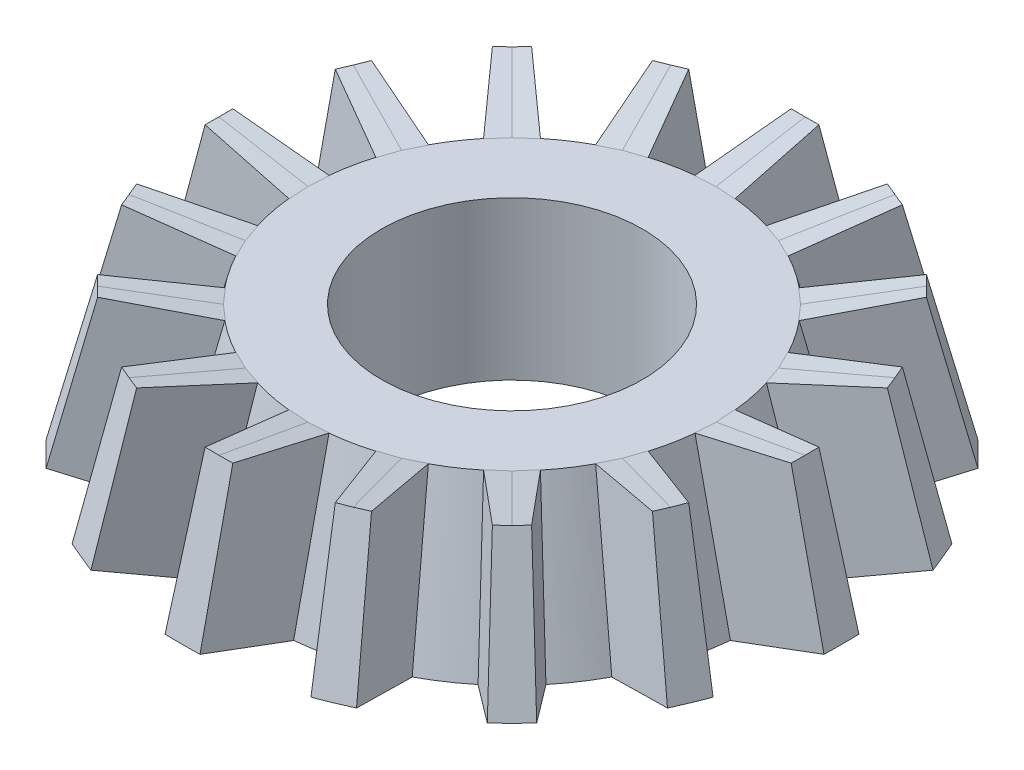
from build123d import *

# Parameters (mm, degrees)
BOSS_EXTRUDE1_DEPTH           = 3.8
BOSS_EXTRUDE1_TAPER           = 4
BOSS_EXTRUDE1_OTHER_WAY_DEPTH = 0.1
BOSS_EXTRUDE1_OTHER_WAY_DRAFT = 4
CIRPATTERN5_COUNT             = 16
CIRPATTERN5_COPY_1_DEPTH      = 0.1
CIRPATTERN5_COPY_1_DRAFT      = 4
CIRPATTERN5_COPY_2_DEPTH      = 0.1
CIRPATTERN5_COPY_2_DRAFT      = 4
CIRPATTERN5_COPY_3_DEPTH      = 0.1
CIRPATTERN5_COPY_3_DRAFT      = 4
CIRPATTERN5_COPY_4_DEPTH      = 0.1
CIRPATTERN5_COPY_4_DRAFT      = 4
CIRPATTERN5_COPY_5_DEPTH      = 0.1
CIRPATTERN5_COPY_5_DRAFT      = 4
CIRPATTERN5_COPY_6_DEPTH      = 0.1
CIRPATTERN5_COPY_6_DRAFT      = 4
CIRPATTERN5_COPY_7_DEPTH      = 0.1
CIRPATTERN5_COPY_7_DRAFT      = 4
CIRPATTERN5_COPY_8_DEPTH      = 0.1
CIRPATTERN5_COPY_8_DRAFT      = 4
CIRPATTERN5_COPY_9_DEPTH      = 0.1
CIRPATTERN5_COPY_9_DRAFT      = 4
CIRPATTERN5_COPY_10_DEPTH     = 0.1
CIRPATTERN5_COPY_10_DRAFT     = 4
CIRPATTERN5_COPY_11_DEPTH     = 0.1
CIRPATTERN5_COPY_11_DRAFT     = 4
CIRPATTERN5_COPY_12_DEPTH     = 0.1
CIRPATTERN5_COPY_12_DRAFT     = 4
CIRPATTERN5_COPY_13_DEPTH     = 0.1
CIRPATTERN5_COPY_13_DRAFT     = 4
CIRPATTERN5_COPY_14_DEPTH     = 0.1
CIRPATTERN5_COPY_14_DRAFT     = 4
CIRPATTERN5_COPY_15_DEPTH     = 0.1
CIRPATTERN5_COPY_15_DRAFT     = 4
CIRPATTERN5_COPY_16_DEPTH     = 0.1
CIRPATTERN5_COPY_16_DRAFT     = 4
CIRPATTERN5_COPY_17_DEPTH     = 0.1
CIRPATTERN5_COPY_17_DRAFT     = 4
CIRPATTERN5_COPY_18_DEPTH     = 0.1
CIRPATTERN5_COPY_18_DRAFT     = 4
CIRPATTERN5_COPY_19_DEPTH     = 0.1
CIRPATTERN5_COPY_19_DRAFT     = 4
CIRPATTERN5_COPY_20_DEPTH     = 0.1
CIRPATTERN5_COPY_20_DRAFT     = 4
CIRPATTERN5_COPY_21_DEPTH     = 0.1
CIRPATTERN5_COPY_21_DRAFT     = 4
CIRPATTERN5_COPY_22_DEPTH     = 0.1
CIRPATTERN5_COPY_22_DRAFT     = 4
CIRPATTERN5_COPY_23_DEPTH     = 0.1
CIRPATTERN5_COPY_23_DRAFT     = 4
CIRPATTERN5_COPY_24_DEPTH     = 0.1
CIRPATTERN5_COPY_24_DRAFT     = 4
CIRPATTERN5_COPY_25_DEPTH     = 0.1
CIRPATTERN5_COPY_25_DRAFT     = 4
CIRPATTERN5_COPY_26_DEPTH     = 0.1
CIRPATTERN5_COPY_26_DRAFT     = 4
CIRPATTERN5_COPY_27_DEPTH     = 0.1
CIRPATTERN5_COPY_27_DRAFT     = 4
CIRPATTERN5_COPY_28_DEPTH     = 0.1
CIRPATTERN5_COPY_28_DRAFT     = 4
CIRPATTERN5_COPY_29_DEPTH     = 0.1
CIRPATTERN5_COPY_29_DRAFT     = 4
CIRPATTERN5_COPY_30_DEPTH     = 0.1
CIRPATTERN5_COPY_30_DRAFT     = 4
SKETCH9_R                     = 5.5
CUT_EXTRUDE1_DEPTH            = 11.5
SKETCH11_R                    = 13.97
CUT_EXTRUDE4_DEPTH            = 10


with BuildPart() as part:
    # Sketch1 → Revolve1 (revolve)
    with BuildSketch(Plane.XY):
        Polygon((0, 0), (10.264, 0), (8.599769277, 6.655068452), (0, 6.655068452), align=None)
    revolve(axis=Axis((0, 6.655068452, 0), (0, -1, 0)))

    # Sketch8 → Boss-Extrude1 (add)
    with BuildSketch(Plane(origin=(0, 2.41565258, 9.659918574), x_dir=(1, 0, 0), z_dir=(0, 0.24259923079541193, 0.9701265964901048))):
        Polygon((0, 4.369961495), (-0.8443, 4.380040474), (-1.0077, -2.478008782), (0, -2.490038505), (1.0077, -2.478008782), (0.8443, 4.380040474), align=None)
    boss_extrude1 = extrude(amount=BOSS_EXTRUDE1_DEPTH, taper=BOSS_EXTRUDE1_TAPER)


with BuildPart() as boss_extrude1_other_way_tool:
    # Sketch8 → Boss-Extrude1 other way (with draft: the straight prism first)
    with BuildSketch(Plane(origin=(0, 2.41565258, 9.659918574), x_dir=(1, 0, 0), z_dir=(0, 0.24259923079541193, 0.9701265964901048))):
        Polygon((0, 4.369961495), (-0.8443, 4.380040474), (-1.0077, -2.478008782), (0, -2.490038505), (1.0077, -2.478008782), (0.8443, 4.380040474), align=None)
    extrude(amount=-BOSS_EXTRUDE1_OTHER_WAY_DEPTH)
    # Boss-Extrude1 other way: the draft: its side faces are tilted about the plane it starts from
    boss_extrude1_other_way_sides = [boss_extrude1_other_way_tool.faces().sort_by_distance(p)[0] for p in [
        (-0.42215, 6.647827433, 8.550040371),
        (-0.926, 3.326128384, 9.380696532),
        (-0.50385, -0.006294784, 10.214034469),
        (0.50385, -0.006294784, 10.214034469),
        (0.926, 3.326128384, 9.380696532),
        (0.42215, 6.647827433, 8.550040371),
    ]]
    draft(boss_extrude1_other_way_sides, Plane(origin=(0, 2.41565258, 9.659918574), x_dir=(1, 0, 0), z_dir=(0, 0.24259923079541193, 0.9701265964901048)), BOSS_EXTRUDE1_OTHER_WAY_DRAFT)


with BuildPart() as part_1:
    add(part.part)

    # Boss-Extrude1 other way: add boss_extrude1_other_way_tool
    add(boss_extrude1_other_way_tool.part)

    # CirPattern5: Boss-Extrude1 ×16 about axis
    cirpattern5_axis = Axis((0, 67.611042395, 0), (0, -1, 0))
    for i in range(1, CIRPATTERN5_COUNT):
        add(boss_extrude1.rotate(cirpattern5_axis, i * 360 / CIRPATTERN5_COUNT))


with BuildPart() as cirpattern5_copy_1_tool:
    # CirPattern5 copy 1 sketch → CirPattern5 copy 1 (with draft: the straight prism first)
    with BuildSketch(Plane(origin=(-3.696690796, 2.41565258, 8.924601056), x_dir=(0.9238795325112867, 0, 0.3826834323650898), z_dir=(-0.37125137577349576, 0.24259923079541193, 0.8962801064420437))):
        Polygon((0, 4.369961495), (-0.8443, 4.380040474), (-1.0077, -2.478008782), (0, -2.490038505), (1.0077, -2.478008782), (0.8443, 4.380040474), align=None)
    extrude(amount=-CIRPATTERN5_COPY_1_DEPTH)
    # CirPattern5 copy 1: the draft: its side faces are tilted about the plane it starts from
    cirpattern5_copy_1_sides = [cirpattern5_copy_1_tool.faces().sort_by_distance(p)[0] for p in [
        (-3.661974541, 6.647827433, 7.73765749),
        (-4.445349594, 3.326128384, 8.312268668),
        (-4.374238471, -0.006294784, 9.243722343),
        (-3.443245066, -0.006294784, 9.629352438),
        (-2.7343247, 3.326128384, 9.020998385),
        (-2.881943051, 6.647827433, 8.060757112),
    ]]
    draft(cirpattern5_copy_1_sides, Plane(origin=(-3.696690796, 2.41565258, 8.924601056), x_dir=(0.9238795325112867, 0, 0.3826834323650898), z_dir=(-0.37125137577349576, 0.24259923079541193, 0.8962801064420437)), CIRPATTERN5_COPY_1_DRAFT)


with BuildPart() as part_2:
    add(part_1.part)

    # CirPattern5 copy 1: add cirpattern5_copy_1_tool
    add(cirpattern5_copy_1_tool.part)


with BuildPart() as cirpattern5_copy_2_tool:
    # CirPattern5 copy 2 sketch → CirPattern5 copy 2 (with draft: the straight prism first)
    with BuildSketch(Plane(origin=(-6.830593929, 2.41565258, 6.830593929), x_dir=(0.7071067811865476, 0, 0.7071067811865475), z_dir=(-0.6859830949875786, 0.24259923079541193, 0.6859830949875787))):
        Polygon((0, 4.369961495), (-0.8443, 4.380040474), (-1.0077, -2.478008782), (0, -2.490038505), (1.0077, -2.478008782), (0.8443, 4.380040474), align=None)
    extrude(amount=-CIRPATTERN5_COPY_2_DEPTH)
    # CirPattern5 copy 2: the draft: its side faces are tilted about the plane it starts from
    cirpattern5_copy_2_sides = [cirpattern5_copy_2_tool.faces().sort_by_distance(p)[0] for p in [
        (-6.344296653, 6.647827433, 5.747286398),
        (-7.287935009, 3.326128384, 5.978373251),
        (-7.578688788, -0.006294784, 6.866137285),
        (-6.866137285, -0.006294784, 7.578688788),
        (-5.978373251, 3.326128384, 7.287935009),
        (-5.747286398, 6.647827433, 6.344296653),
    ]]
    draft(cirpattern5_copy_2_sides, Plane(origin=(-6.830593929, 2.41565258, 6.830593929), x_dir=(0.7071067811865476, 0, 0.7071067811865475), z_dir=(-0.6859830949875786, 0.24259923079541193, 0.6859830949875787)), CIRPATTERN5_COPY_2_DRAFT)


with BuildPart() as part_3:
    add(part_2.part)

    # CirPattern5 copy 2: add cirpattern5_copy_2_tool
    add(cirpattern5_copy_2_tool.part)


with BuildPart() as cirpattern5_copy_3_tool:
    # CirPattern5 copy 3 sketch → CirPattern5 copy 3 (with draft: the straight prism first)
    with BuildSketch(Plane(origin=(-8.924601056, 2.41565258, 3.696690796), x_dir=(0.38268343236508984, 0, 0.9238795325112867), z_dir=(-0.8962801064420437, 0.24259923079541193, 0.3712513757734958))):
        Polygon((0, 4.369961495), (-0.8443, 4.380040474), (-1.0077, -2.478008782), (0, -2.490038505), (1.0077, -2.478008782), (0.8443, 4.380040474), align=None)
    extrude(amount=-CIRPATTERN5_COPY_3_DEPTH)
    # CirPattern5 copy 3: the draft: its side faces are tilted about the plane it starts from
    cirpattern5_copy_3_sides = [cirpattern5_copy_3_tool.faces().sort_by_distance(p)[0] for p in [
        (-8.060757112, 6.647827433, 2.881943051),
        (-9.020998385, 3.326128384, 2.7343247),
        (-9.629352438, -0.006294784, 3.443245066),
        (-9.243722343, -0.006294784, 4.374238471),
        (-8.312268668, 3.326128384, 4.445349594),
        (-7.73765749, 6.647827433, 3.661974541),
    ]]
    draft(cirpattern5_copy_3_sides, Plane(origin=(-8.924601056, 2.41565258, 3.696690796), x_dir=(0.38268343236508984, 0, 0.9238795325112867), z_dir=(-0.8962801064420437, 0.24259923079541193, 0.3712513757734958)), CIRPATTERN5_COPY_3_DRAFT)


with BuildPart() as part_4:
    add(part_3.part)

    # CirPattern5 copy 3: add cirpattern5_copy_3_tool
    add(cirpattern5_copy_3_tool.part)


with BuildPart() as cirpattern5_copy_4_tool:
    # CirPattern5 copy 4 sketch → CirPattern5 copy 4 (with draft: the straight prism first)
    with BuildSketch(Plane(origin=(-9.659918574, 2.41565258, 0), x_dir=(0, 0, 1), z_dir=(-0.9701265964901048, 0.24259923079541193, 0))):
        Polygon((0, 4.369961495), (-0.8443, 4.380040474), (-1.0077, -2.478008782), (0, -2.490038505), (1.0077, -2.478008782), (0.8443, 4.380040474), align=None)
    extrude(amount=-CIRPATTERN5_COPY_4_DEPTH)
    # CirPattern5 copy 4: the draft: its side faces are tilted about the plane it starts from
    cirpattern5_copy_4_sides = [cirpattern5_copy_4_tool.faces().sort_by_distance(p)[0] for p in [
        (-8.550040371, 6.647827433, -0.42215),
        (-9.380696532, 3.326128384, -0.926),
        (-10.214034469, -0.006294784, -0.50385),
        (-10.214034469, -0.006294784, 0.50385),
        (-9.380696532, 3.326128384, 0.926),
        (-8.550040371, 6.647827433, 0.42215),
    ]]
    draft(cirpattern5_copy_4_sides, Plane(origin=(-9.659918574, 2.41565258, 0), x_dir=(0, 0, 1), z_dir=(-0.9701265964901048, 0.24259923079541193, 0)), CIRPATTERN5_COPY_4_DRAFT)


with BuildPart() as part_5:
    add(part_4.part)

    # CirPattern5 copy 4: add cirpattern5_copy_4_tool
    add(cirpattern5_copy_4_tool.part)


with BuildPart() as cirpattern5_copy_5_tool:
    # CirPattern5 copy 5 sketch → CirPattern5 copy 5 (with draft: the straight prism first)
    with BuildSketch(Plane(origin=(-8.924601056, 2.41565258, -3.696690796), x_dir=(-0.3826834323650897, 0, 0.9238795325112867), z_dir=(-0.8962801064420437, 0.2425992307954119, -0.3712513757734957))):
        Polygon((0, 4.369961495), (-0.8443, 4.380040474), (-1.0077, -2.478008782), (0, -2.490038505), (1.0077, -2.478008782), (0.8443, 4.380040474), align=None)
    extrude(amount=-CIRPATTERN5_COPY_5_DEPTH)
    # CirPattern5 copy 5: the draft: its side faces are tilted about the plane it starts from
    cirpattern5_copy_5_sides = [cirpattern5_copy_5_tool.faces().sort_by_distance(p)[0] for p in [
        (-7.73765749, 6.647827433, -3.661974541),
        (-8.312268668, 3.326128384, -4.445349594),
        (-9.243722343, -0.006294784, -4.374238471),
        (-9.629352438, -0.006294784, -3.443245066),
        (-9.020998385, 3.326128384, -2.7343247),
        (-8.060757112, 6.647827433, -2.881943051),
    ]]
    draft(cirpattern5_copy_5_sides, Plane(origin=(-8.924601056, 2.41565258, -3.696690796), x_dir=(-0.3826834323650897, 0, 0.9238795325112867), z_dir=(-0.8962801064420437, 0.2425992307954119, -0.3712513757734957)), CIRPATTERN5_COPY_5_DRAFT)


with BuildPart() as part_6:
    add(part_5.part)

    # CirPattern5 copy 5: add cirpattern5_copy_5_tool
    add(cirpattern5_copy_5_tool.part)


with BuildPart() as cirpattern5_copy_6_tool:
    # CirPattern5 copy 6 sketch → CirPattern5 copy 6 (with draft: the straight prism first)
    with BuildSketch(Plane(origin=(-6.830593929, 2.41565258, -6.830593929), x_dir=(-0.7071067811865475, 0, 0.7071067811865476), z_dir=(-0.6859830949875787, 0.24259923079541193, -0.6859830949875786))):
        Polygon((0, 4.369961495), (-0.8443, 4.380040474), (-1.0077, -2.478008782), (0, -2.490038505), (1.0077, -2.478008782), (0.8443, 4.380040474), align=None)
    extrude(amount=-CIRPATTERN5_COPY_6_DEPTH)
    # CirPattern5 copy 6: the draft: its side faces are tilted about the plane it starts from
    cirpattern5_copy_6_sides = [cirpattern5_copy_6_tool.faces().sort_by_distance(p)[0] for p in [
        (-5.747286398, 6.647827433, -6.344296653),
        (-5.978373251, 3.326128384, -7.287935009),
        (-6.866137285, -0.006294784, -7.578688788),
        (-7.578688788, -0.006294784, -6.866137285),
        (-7.287935009, 3.326128384, -5.978373251),
        (-6.344296653, 6.647827433, -5.747286398),
    ]]
    draft(cirpattern5_copy_6_sides, Plane(origin=(-6.830593929, 2.41565258, -6.830593929), x_dir=(-0.7071067811865475, 0, 0.7071067811865476), z_dir=(-0.6859830949875787, 0.24259923079541193, -0.6859830949875786)), CIRPATTERN5_COPY_6_DRAFT)


with BuildPart() as part_7:
    add(part_6.part)

    # CirPattern5 copy 6: add cirpattern5_copy_6_tool
    add(cirpattern5_copy_6_tool.part)


with BuildPart() as cirpattern5_copy_7_tool:
    # CirPattern5 copy 7 sketch → CirPattern5 copy 7 (with draft: the straight prism first)
    with BuildSketch(Plane(origin=(-3.696690796, 2.41565258, -8.924601056), x_dir=(-0.9238795325112867, 0, 0.3826834323650899), z_dir=(-0.3712513757734959, 0.24259923079541193, -0.8962801064420437))):
        Polygon((0, 4.369961495), (-0.8443, 4.380040474), (-1.0077, -2.478008782), (0, -2.490038505), (1.0077, -2.478008782), (0.8443, 4.380040474), align=None)
    extrude(amount=-CIRPATTERN5_COPY_7_DEPTH)
    # CirPattern5 copy 7: the draft: its side faces are tilted about the plane it starts from
    cirpattern5_copy_7_sides = [cirpattern5_copy_7_tool.faces().sort_by_distance(p)[0] for p in [
        (-2.881943051, 6.647827433, -8.060757112),
        (-2.7343247, 3.326128384, -9.020998385),
        (-3.443245066, -0.006294784, -9.629352438),
        (-4.374238471, -0.006294784, -9.243722343),
        (-4.445349594, 3.326128384, -8.312268668),
        (-3.661974541, 6.647827433, -7.73765749),
    ]]
    draft(cirpattern5_copy_7_sides, Plane(origin=(-3.696690796, 2.41565258, -8.924601056), x_dir=(-0.9238795325112867, 0, 0.3826834323650899), z_dir=(-0.3712513757734959, 0.24259923079541193, -0.8962801064420437)), CIRPATTERN5_COPY_7_DRAFT)


with BuildPart() as part_8:
    add(part_7.part)

    # CirPattern5 copy 7: add cirpattern5_copy_7_tool
    add(cirpattern5_copy_7_tool.part)


with BuildPart() as cirpattern5_copy_8_tool:
    # CirPattern5 copy 8 sketch → CirPattern5 copy 8 (with draft: the straight prism first)
    with BuildSketch(Plane(origin=(0, 2.41565258, -9.659918574), x_dir=(-1, 0, 0), z_dir=(0, 0.24259923079541193, -0.9701265964901048))):
        Polygon((0, 4.369961495), (-0.8443, 4.380040474), (-1.0077, -2.478008782), (0, -2.490038505), (1.0077, -2.478008782), (0.8443, 4.380040474), align=None)
    extrude(amount=-CIRPATTERN5_COPY_8_DEPTH)
    # CirPattern5 copy 8: the draft: its side faces are tilted about the plane it starts from
    cirpattern5_copy_8_sides = [cirpattern5_copy_8_tool.faces().sort_by_distance(p)[0] for p in [
        (0.42215, 6.647827433, -8.550040371),
        (0.926, 3.326128384, -9.380696532),
        (0.50385, -0.006294784, -10.214034469),
        (-0.50385, -0.006294784, -10.214034469),
        (-0.926, 3.326128384, -9.380696532),
        (-0.42215, 6.647827433, -8.550040371),
    ]]
    draft(cirpattern5_copy_8_sides, Plane(origin=(0, 2.41565258, -9.659918574), x_dir=(-1, 0, 0), z_dir=(0, 0.24259923079541193, -0.9701265964901048)), CIRPATTERN5_COPY_8_DRAFT)


with BuildPart() as part_9:
    add(part_8.part)

    # CirPattern5 copy 8: add cirpattern5_copy_8_tool
    add(cirpattern5_copy_8_tool.part)


with BuildPart() as cirpattern5_copy_9_tool:
    # CirPattern5 copy 9 sketch → CirPattern5 copy 9 (with draft: the straight prism first)
    with BuildSketch(Plane(origin=(3.696690796, 2.41565258, -8.924601056), x_dir=(-0.9238795325112868, 0, -0.38268343236508967), z_dir=(0.37125137577349565, 0.24259923079541193, -0.8962801064420438))):
        Polygon((0, 4.369961495), (-0.8443, 4.380040474), (-1.0077, -2.478008782), (0, -2.490038505), (1.0077, -2.478008782), (0.8443, 4.380040474), align=None)
    extrude(amount=-CIRPATTERN5_COPY_9_DEPTH)
    # CirPattern5 copy 9: the draft: its side faces are tilted about the plane it starts from
    cirpattern5_copy_9_sides = [cirpattern5_copy_9_tool.faces().sort_by_distance(p)[0] for p in [
        (3.661974541, 6.647827433, -7.73765749),
        (4.445349594, 3.326128384, -8.312268668),
        (4.374238471, -0.006294784, -9.243722343),
        (3.443245066, -0.006294784, -9.629352438),
        (2.7343247, 3.326128384, -9.020998385),
        (2.881943051, 6.647827433, -8.060757112),
    ]]
    draft(cirpattern5_copy_9_sides, Plane(origin=(3.696690796, 2.41565258, -8.924601056), x_dir=(-0.9238795325112868, 0, -0.38268343236508967), z_dir=(0.37125137577349565, 0.24259923079541193, -0.8962801064420438)), CIRPATTERN5_COPY_9_DRAFT)


with BuildPart() as part_10:
    add(part_9.part)

    # CirPattern5 copy 9: add cirpattern5_copy_9_tool
    add(cirpattern5_copy_9_tool.part)


with BuildPart() as cirpattern5_copy_10_tool:
    # CirPattern5 copy 10 sketch → CirPattern5 copy 10 (with draft: the straight prism first)
    with BuildSketch(Plane(origin=(6.830593929, 2.41565258, -6.830593929), x_dir=(-0.7071067811865477, 0, -0.7071067811865475), z_dir=(0.6859830949875786, 0.24259923079541193, -0.6859830949875788))):
        Polygon((0, 4.369961495), (-0.8443, 4.380040474), (-1.0077, -2.478008782), (0, -2.490038505), (1.0077, -2.478008782), (0.8443, 4.380040474), align=None)
    extrude(amount=-CIRPATTERN5_COPY_10_DEPTH)
    # CirPattern5 copy 10: the draft: its side faces are tilted about the plane it starts from
    cirpattern5_copy_10_sides = [cirpattern5_copy_10_tool.faces().sort_by_distance(p)[0] for p in [
        (6.344296653, 6.647827433, -5.747286398),
        (7.287935009, 3.326128384, -5.978373251),
        (7.578688788, -0.006294784, -6.866137285),
        (6.866137285, -0.006294784, -7.578688788),
        (5.978373251, 3.326128384, -7.287935009),
        (5.747286398, 6.647827433, -6.344296653),
    ]]
    draft(cirpattern5_copy_10_sides, Plane(origin=(6.830593929, 2.41565258, -6.830593929), x_dir=(-0.7071067811865477, 0, -0.7071067811865475), z_dir=(0.6859830949875786, 0.24259923079541193, -0.6859830949875788)), CIRPATTERN5_COPY_10_DRAFT)


with BuildPart() as part_11:
    add(part_10.part)

    # CirPattern5 copy 10: add cirpattern5_copy_10_tool
    add(cirpattern5_copy_10_tool.part)


with BuildPart() as cirpattern5_copy_11_tool:
    # CirPattern5 copy 11 sketch → CirPattern5 copy 11 (with draft: the straight prism first)
    with BuildSketch(Plane(origin=(8.924601056, 2.41565258, -3.696690796), x_dir=(-0.3826834323650895, 0, -0.9238795325112868), z_dir=(0.8962801064420438, 0.24259923079541193, -0.3712513757734955))):
        Polygon((0, 4.369961495), (-0.8443, 4.380040474), (-1.0077, -2.478008782), (0, -2.490038505), (1.0077, -2.478008782), (0.8443, 4.380040474), align=None)
    extrude(amount=-CIRPATTERN5_COPY_11_DEPTH)
    # CirPattern5 copy 11: the draft: its side faces are tilted about the plane it starts from
    cirpattern5_copy_11_sides = [cirpattern5_copy_11_tool.faces().sort_by_distance(p)[0] for p in [
        (8.060757112, 6.647827433, -2.881943051),
        (9.020998385, 3.326128384, -2.7343247),
        (9.629352438, -0.006294784, -3.443245066),
        (9.243722343, -0.006294784, -4.374238471),
        (8.312268668, 3.326128384, -4.445349594),
        (7.73765749, 6.647827433, -3.661974541),
    ]]
    draft(cirpattern5_copy_11_sides, Plane(origin=(8.924601056, 2.41565258, -3.696690796), x_dir=(-0.3826834323650895, 0, -0.9238795325112868), z_dir=(0.8962801064420438, 0.24259923079541193, -0.3712513757734955)), CIRPATTERN5_COPY_11_DRAFT)


with BuildPart() as part_12:
    add(part_11.part)

    # CirPattern5 copy 11: add cirpattern5_copy_11_tool
    add(cirpattern5_copy_11_tool.part)


with BuildPart() as cirpattern5_copy_12_tool:
    # CirPattern5 copy 12 sketch → CirPattern5 copy 12 (with draft: the straight prism first)
    with BuildSketch(Plane(origin=(9.659918574, 2.41565258, 0), x_dir=(0, 0, -1), z_dir=(0.9701265964901048, 0.24259923079541193, 0))):
        Polygon((0, 4.369961495), (-0.8443, 4.380040474), (-1.0077, -2.478008782), (0, -2.490038505), (1.0077, -2.478008782), (0.8443, 4.380040474), align=None)
    extrude(amount=-CIRPATTERN5_COPY_12_DEPTH)
    # CirPattern5 copy 12: the draft: its side faces are tilted about the plane it starts from
    cirpattern5_copy_12_sides = [cirpattern5_copy_12_tool.faces().sort_by_distance(p)[0] for p in [
        (8.550040371, 6.647827433, 0.42215),
        (9.380696532, 3.326128384, 0.926),
        (10.214034469, -0.006294784, 0.50385),
        (10.214034469, -0.006294784, -0.50385),
        (9.380696532, 3.326128384, -0.926),
        (8.550040371, 6.647827433, -0.42215),
    ]]
    draft(cirpattern5_copy_12_sides, Plane(origin=(9.659918574, 2.41565258, 0), x_dir=(0, 0, -1), z_dir=(0.9701265964901048, 0.24259923079541193, 0)), CIRPATTERN5_COPY_12_DRAFT)


with BuildPart() as part_13:
    add(part_12.part)

    # CirPattern5 copy 12: add cirpattern5_copy_12_tool
    add(cirpattern5_copy_12_tool.part)


with BuildPart() as cirpattern5_copy_13_tool:
    # CirPattern5 copy 13 sketch → CirPattern5 copy 13 (with draft: the straight prism first)
    with BuildSketch(Plane(origin=(8.924601056, 2.41565258, 3.696690796), x_dir=(0.38268343236509, 0, -0.9238795325112866), z_dir=(0.8962801064420436, 0.24259923079541193, 0.371251375773496))):
        Polygon((0, 4.369961495), (-0.8443, 4.380040474), (-1.0077, -2.478008782), (0, -2.490038505), (1.0077, -2.478008782), (0.8443, 4.380040474), align=None)
    extrude(amount=-CIRPATTERN5_COPY_13_DEPTH)
    # CirPattern5 copy 13: the draft: its side faces are tilted about the plane it starts from
    cirpattern5_copy_13_sides = [cirpattern5_copy_13_tool.faces().sort_by_distance(p)[0] for p in [
        (7.73765749, 6.647827433, 3.661974541),
        (8.312268668, 3.326128384, 4.445349594),
        (9.243722343, -0.006294784, 4.374238471),
        (9.629352438, -0.006294784, 3.443245066),
        (9.020998385, 3.326128384, 2.7343247),
        (8.060757112, 6.647827433, 2.881943051),
    ]]
    draft(cirpattern5_copy_13_sides, Plane(origin=(8.924601056, 2.41565258, 3.696690796), x_dir=(0.38268343236509, 0, -0.9238795325112866), z_dir=(0.8962801064420436, 0.24259923079541193, 0.371251375773496)), CIRPATTERN5_COPY_13_DRAFT)


with BuildPart() as part_14:
    add(part_13.part)

    # CirPattern5 copy 13: add cirpattern5_copy_13_tool
    add(cirpattern5_copy_13_tool.part)


with BuildPart() as cirpattern5_copy_14_tool:
    # CirPattern5 copy 14 sketch → CirPattern5 copy 14 (with draft: the straight prism first)
    with BuildSketch(Plane(origin=(6.830593929, 2.41565258, 6.830593929), x_dir=(0.7071067811865474, 0, -0.7071067811865477), z_dir=(0.6859830949875788, 0.24259923079541193, 0.6859830949875785))):
        Polygon((0, 4.369961495), (-0.8443, 4.380040474), (-1.0077, -2.478008782), (0, -2.490038505), (1.0077, -2.478008782), (0.8443, 4.380040474), align=None)
    extrude(amount=-CIRPATTERN5_COPY_14_DEPTH)
    # CirPattern5 copy 14: the draft: its side faces are tilted about the plane it starts from
    cirpattern5_copy_14_sides = [cirpattern5_copy_14_tool.faces().sort_by_distance(p)[0] for p in [
        (5.747286398, 6.647827433, 6.344296653),
        (5.978373251, 3.326128384, 7.287935009),
        (6.866137285, -0.006294784, 7.578688788),
        (7.578688788, -0.006294784, 6.866137285),
        (7.287935009, 3.326128384, 5.978373251),
        (6.344296653, 6.647827433, 5.747286398),
    ]]
    draft(cirpattern5_copy_14_sides, Plane(origin=(6.830593929, 2.41565258, 6.830593929), x_dir=(0.7071067811865474, 0, -0.7071067811865477), z_dir=(0.6859830949875788, 0.24259923079541193, 0.6859830949875785)), CIRPATTERN5_COPY_14_DRAFT)


with BuildPart() as part_15:
    add(part_14.part)

    # CirPattern5 copy 14: add cirpattern5_copy_14_tool
    add(cirpattern5_copy_14_tool.part)


with BuildPart() as cirpattern5_copy_15_tool:
    # CirPattern5 copy 15 sketch → CirPattern5 copy 15 (with draft: the straight prism first)
    with BuildSketch(Plane(origin=(3.696690796, 2.41565258, 8.924601056), x_dir=(0.9238795325112868, 0, -0.38268343236508956), z_dir=(0.37125137577349554, 0.24259923079541193, 0.8962801064420438))):
        Polygon((0, 4.369961495), (-0.8443, 4.380040474), (-1.0077, -2.478008782), (0, -2.490038505), (1.0077, -2.478008782), (0.8443, 4.380040474), align=None)
    extrude(amount=-CIRPATTERN5_COPY_15_DEPTH)
    # CirPattern5 copy 15: the draft: its side faces are tilted about the plane it starts from
    cirpattern5_copy_15_sides = [cirpattern5_copy_15_tool.faces().sort_by_distance(p)[0] for p in [
        (2.881943051, 6.647827433, 8.060757112),
        (2.7343247, 3.326128384, 9.020998385),
        (3.443245066, -0.006294784, 9.629352438),
        (4.374238471, -0.006294784, 9.243722343),
        (4.445349594, 3.326128384, 8.312268668),
        (3.661974541, 6.647827433, 7.73765749),
    ]]
    draft(cirpattern5_copy_15_sides, Plane(origin=(3.696690796, 2.41565258, 8.924601056), x_dir=(0.9238795325112868, 0, -0.38268343236508956), z_dir=(0.37125137577349554, 0.24259923079541193, 0.8962801064420438)), CIRPATTERN5_COPY_15_DRAFT)


with BuildPart() as part_16:
    add(part_15.part)

    # CirPattern5 copy 15: add cirpattern5_copy_15_tool
    add(cirpattern5_copy_15_tool.part)


with BuildPart() as cirpattern5_copy_16_tool:
    # CirPattern5 copy 16 sketch → CirPattern5 copy 16 (with draft: the straight prism first)
    with BuildSketch(Plane(origin=(-3.696690796, 2.41565258, 8.924601056), x_dir=(0.9238795325112867, 0, 0.3826834323650898), z_dir=(-0.37125137577349576, 0.24259923079541193, 0.8962801064420437))):
        Polygon((0, 4.369961495), (-0.8443, 4.380040474), (-1.0077, -2.478008782), (0, -2.490038505), (1.0077, -2.478008782), (0.8443, 4.380040474), align=None)
    extrude(amount=-CIRPATTERN5_COPY_16_DEPTH)
    # CirPattern5 copy 16: the draft: its side faces are tilted about the plane it starts from
    cirpattern5_copy_16_sides = [cirpattern5_copy_16_tool.faces().sort_by_distance(p)[0] for p in [
        (-3.661974541, 6.647827433, 7.73765749),
        (-4.445349594, 3.326128384, 8.312268668),
        (-4.374238471, -0.006294784, 9.243722343),
        (-3.443245066, -0.006294784, 9.629352438),
        (-2.7343247, 3.326128384, 9.020998385),
        (-2.881943051, 6.647827433, 8.060757112),
    ]]
    draft(cirpattern5_copy_16_sides, Plane(origin=(-3.696690796, 2.41565258, 8.924601056), x_dir=(0.9238795325112867, 0, 0.3826834323650898), z_dir=(-0.37125137577349576, 0.24259923079541193, 0.8962801064420437)), CIRPATTERN5_COPY_16_DRAFT)


with BuildPart() as part_17:
    add(part_16.part)

    # CirPattern5 copy 16: add cirpattern5_copy_16_tool
    add(cirpattern5_copy_16_tool.part)


with BuildPart() as cirpattern5_copy_17_tool:
    # CirPattern5 copy 17 sketch → CirPattern5 copy 17 (with draft: the straight prism first)
    with BuildSketch(Plane(origin=(-6.830593929, 2.41565258, 6.830593929), x_dir=(0.7071067811865476, 0, 0.7071067811865475), z_dir=(-0.6859830949875786, 0.24259923079541193, 0.6859830949875787))):
        Polygon((0, 4.369961495), (-0.8443, 4.380040474), (-1.0077, -2.478008782), (0, -2.490038505), (1.0077, -2.478008782), (0.8443, 4.380040474), align=None)
    extrude(amount=-CIRPATTERN5_COPY_17_DEPTH)
    # CirPattern5 copy 17: the draft: its side faces are tilted about the plane it starts from
    cirpattern5_copy_17_sides = [cirpattern5_copy_17_tool.faces().sort_by_distance(p)[0] for p in [
        (-6.344296653, 6.647827433, 5.747286398),
        (-7.287935009, 3.326128384, 5.978373251),
        (-7.578688788, -0.006294784, 6.866137285),
        (-6.866137285, -0.006294784, 7.578688788),
        (-5.978373251, 3.326128384, 7.287935009),
        (-5.747286398, 6.647827433, 6.344296653),
    ]]
    draft(cirpattern5_copy_17_sides, Plane(origin=(-6.830593929, 2.41565258, 6.830593929), x_dir=(0.7071067811865476, 0, 0.7071067811865475), z_dir=(-0.6859830949875786, 0.24259923079541193, 0.6859830949875787)), CIRPATTERN5_COPY_17_DRAFT)


with BuildPart() as part_18:
    add(part_17.part)

    # CirPattern5 copy 17: add cirpattern5_copy_17_tool
    add(cirpattern5_copy_17_tool.part)


with BuildPart() as cirpattern5_copy_18_tool:
    # CirPattern5 copy 18 sketch → CirPattern5 copy 18 (with draft: the straight prism first)
    with BuildSketch(Plane(origin=(-8.924601056, 2.41565258, 3.696690796), x_dir=(0.38268343236508984, 0, 0.9238795325112867), z_dir=(-0.8962801064420437, 0.24259923079541193, 0.3712513757734958))):
        Polygon((0, 4.369961495), (-0.8443, 4.380040474), (-1.0077, -2.478008782), (0, -2.490038505), (1.0077, -2.478008782), (0.8443, 4.380040474), align=None)
    extrude(amount=-CIRPATTERN5_COPY_18_DEPTH)
    # CirPattern5 copy 18: the draft: its side faces are tilted about the plane it starts from
    cirpattern5_copy_18_sides = [cirpattern5_copy_18_tool.faces().sort_by_distance(p)[0] for p in [
        (-8.060757112, 6.647827433, 2.881943051),
        (-9.020998385, 3.326128384, 2.7343247),
        (-9.629352438, -0.006294784, 3.443245066),
        (-9.243722343, -0.006294784, 4.374238471),
        (-8.312268668, 3.326128384, 4.445349594),
        (-7.73765749, 6.647827433, 3.661974541),
    ]]
    draft(cirpattern5_copy_18_sides, Plane(origin=(-8.924601056, 2.41565258, 3.696690796), x_dir=(0.38268343236508984, 0, 0.9238795325112867), z_dir=(-0.8962801064420437, 0.24259923079541193, 0.3712513757734958)), CIRPATTERN5_COPY_18_DRAFT)


with BuildPart() as part_19:
    add(part_18.part)

    # CirPattern5 copy 18: add cirpattern5_copy_18_tool
    add(cirpattern5_copy_18_tool.part)


with BuildPart() as cirpattern5_copy_19_tool:
    # CirPattern5 copy 19 sketch → CirPattern5 copy 19 (with draft: the straight prism first)
    with BuildSketch(Plane(origin=(-9.659918574, 2.41565258, 0), x_dir=(0, 0, 1), z_dir=(-0.9701265964901048, 0.24259923079541193, 0))):
        Polygon((0, 4.369961495), (-0.8443, 4.380040474), (-1.0077, -2.478008782), (0, -2.490038505), (1.0077, -2.478008782), (0.8443, 4.380040474), align=None)
    extrude(amount=-CIRPATTERN5_COPY_19_DEPTH)
    # CirPattern5 copy 19: the draft: its side faces are tilted about the plane it starts from
    cirpattern5_copy_19_sides = [cirpattern5_copy_19_tool.faces().sort_by_distance(p)[0] for p in [
        (-8.550040371, 6.647827433, -0.42215),
        (-9.380696532, 3.326128384, -0.926),
        (-10.214034469, -0.006294784, -0.50385),
        (-10.214034469, -0.006294784, 0.50385),
        (-9.380696532, 3.326128384, 0.926),
        (-8.550040371, 6.647827433, 0.42215),
    ]]
    draft(cirpattern5_copy_19_sides, Plane(origin=(-9.659918574, 2.41565258, 0), x_dir=(0, 0, 1), z_dir=(-0.9701265964901048, 0.24259923079541193, 0)), CIRPATTERN5_COPY_19_DRAFT)


with BuildPart() as part_20:
    add(part_19.part)

    # CirPattern5 copy 19: add cirpattern5_copy_19_tool
    add(cirpattern5_copy_19_tool.part)


with BuildPart() as cirpattern5_copy_20_tool:
    # CirPattern5 copy 20 sketch → CirPattern5 copy 20 (with draft: the straight prism first)
    with BuildSketch(Plane(origin=(-8.924601056, 2.41565258, -3.696690796), x_dir=(-0.3826834323650897, 0, 0.9238795325112867), z_dir=(-0.8962801064420437, 0.2425992307954119, -0.3712513757734957))):
        Polygon((0, 4.369961495), (-0.8443, 4.380040474), (-1.0077, -2.478008782), (0, -2.490038505), (1.0077, -2.478008782), (0.8443, 4.380040474), align=None)
    extrude(amount=-CIRPATTERN5_COPY_20_DEPTH)
    # CirPattern5 copy 20: the draft: its side faces are tilted about the plane it starts from
    cirpattern5_copy_20_sides = [cirpattern5_copy_20_tool.faces().sort_by_distance(p)[0] for p in [
        (-7.73765749, 6.647827433, -3.661974541),
        (-8.312268668, 3.326128384, -4.445349594),
        (-9.243722343, -0.006294784, -4.374238471),
        (-9.629352438, -0.006294784, -3.443245066),
        (-9.020998385, 3.326128384, -2.7343247),
        (-8.060757112, 6.647827433, -2.881943051),
    ]]
    draft(cirpattern5_copy_20_sides, Plane(origin=(-8.924601056, 2.41565258, -3.696690796), x_dir=(-0.3826834323650897, 0, 0.9238795325112867), z_dir=(-0.8962801064420437, 0.2425992307954119, -0.3712513757734957)), CIRPATTERN5_COPY_20_DRAFT)


with BuildPart() as part_21:
    add(part_20.part)

    # CirPattern5 copy 20: add cirpattern5_copy_20_tool
    add(cirpattern5_copy_20_tool.part)


with BuildPart() as cirpattern5_copy_21_tool:
    # CirPattern5 copy 21 sketch → CirPattern5 copy 21 (with draft: the straight prism first)
    with BuildSketch(Plane(origin=(-6.830593929, 2.41565258, -6.830593929), x_dir=(-0.7071067811865475, 0, 0.7071067811865476), z_dir=(-0.6859830949875787, 0.24259923079541193, -0.6859830949875786))):
        Polygon((0, 4.369961495), (-0.8443, 4.380040474), (-1.0077, -2.478008782), (0, -2.490038505), (1.0077, -2.478008782), (0.8443, 4.380040474), align=None)
    extrude(amount=-CIRPATTERN5_COPY_21_DEPTH)
    # CirPattern5 copy 21: the draft: its side faces are tilted about the plane it starts from
    cirpattern5_copy_21_sides = [cirpattern5_copy_21_tool.faces().sort_by_distance(p)[0] for p in [
        (-5.747286398, 6.647827433, -6.344296653),
        (-5.978373251, 3.326128384, -7.287935009),
        (-6.866137285, -0.006294784, -7.578688788),
        (-7.578688788, -0.006294784, -6.866137285),
        (-7.287935009, 3.326128384, -5.978373251),
        (-6.344296653, 6.647827433, -5.747286398),
    ]]
    draft(cirpattern5_copy_21_sides, Plane(origin=(-6.830593929, 2.41565258, -6.830593929), x_dir=(-0.7071067811865475, 0, 0.7071067811865476), z_dir=(-0.6859830949875787, 0.24259923079541193, -0.6859830949875786)), CIRPATTERN5_COPY_21_DRAFT)


with BuildPart() as part_22:
    add(part_21.part)

    # CirPattern5 copy 21: add cirpattern5_copy_21_tool
    add(cirpattern5_copy_21_tool.part)


with BuildPart() as cirpattern5_copy_22_tool:
    # CirPattern5 copy 22 sketch → CirPattern5 copy 22 (with draft: the straight prism first)
    with BuildSketch(Plane(origin=(-3.696690796, 2.41565258, -8.924601056), x_dir=(-0.9238795325112867, 0, 0.3826834323650899), z_dir=(-0.3712513757734959, 0.24259923079541193, -0.8962801064420437))):
        Polygon((0, 4.369961495), (-0.8443, 4.380040474), (-1.0077, -2.478008782), (0, -2.490038505), (1.0077, -2.478008782), (0.8443, 4.380040474), align=None)
    extrude(amount=-CIRPATTERN5_COPY_22_DEPTH)
    # CirPattern5 copy 22: the draft: its side faces are tilted about the plane it starts from
    cirpattern5_copy_22_sides = [cirpattern5_copy_22_tool.faces().sort_by_distance(p)[0] for p in [
        (-2.881943051, 6.647827433, -8.060757112),
        (-2.7343247, 3.326128384, -9.020998385),
        (-3.443245066, -0.006294784, -9.629352438),
        (-4.374238471, -0.006294784, -9.243722343),
        (-4.445349594, 3.326128384, -8.312268668),
        (-3.661974541, 6.647827433, -7.73765749),
    ]]
    draft(cirpattern5_copy_22_sides, Plane(origin=(-3.696690796, 2.41565258, -8.924601056), x_dir=(-0.9238795325112867, 0, 0.3826834323650899), z_dir=(-0.3712513757734959, 0.24259923079541193, -0.8962801064420437)), CIRPATTERN5_COPY_22_DRAFT)


with BuildPart() as part_23:
    add(part_22.part)

    # CirPattern5 copy 22: add cirpattern5_copy_22_tool
    add(cirpattern5_copy_22_tool.part)


with BuildPart() as cirpattern5_copy_23_tool:
    # CirPattern5 copy 23 sketch → CirPattern5 copy 23 (with draft: the straight prism first)
    with BuildSketch(Plane(origin=(0, 2.41565258, -9.659918574), x_dir=(-1, 0, 0), z_dir=(0, 0.24259923079541193, -0.9701265964901048))):
        Polygon((0, 4.369961495), (-0.8443, 4.380040474), (-1.0077, -2.478008782), (0, -2.490038505), (1.0077, -2.478008782), (0.8443, 4.380040474), align=None)
    extrude(amount=-CIRPATTERN5_COPY_23_DEPTH)
    # CirPattern5 copy 23: the draft: its side faces are tilted about the plane it starts from
    cirpattern5_copy_23_sides = [cirpattern5_copy_23_tool.faces().sort_by_distance(p)[0] for p in [
        (0.42215, 6.647827433, -8.550040371),
        (0.926, 3.326128384, -9.380696532),
        (0.50385, -0.006294784, -10.214034469),
        (-0.50385, -0.006294784, -10.214034469),
        (-0.926, 3.326128384, -9.380696532),
        (-0.42215, 6.647827433, -8.550040371),
    ]]
    draft(cirpattern5_copy_23_sides, Plane(origin=(0, 2.41565258, -9.659918574), x_dir=(-1, 0, 0), z_dir=(0, 0.24259923079541193, -0.9701265964901048)), CIRPATTERN5_COPY_23_DRAFT)


with BuildPart() as part_24:
    add(part_23.part)

    # CirPattern5 copy 23: add cirpattern5_copy_23_tool
    add(cirpattern5_copy_23_tool.part)


with BuildPart() as cirpattern5_copy_24_tool:
    # CirPattern5 copy 24 sketch → CirPattern5 copy 24 (with draft: the straight prism first)
    with BuildSketch(Plane(origin=(3.696690796, 2.41565258, -8.924601056), x_dir=(-0.9238795325112868, 0, -0.38268343236508967), z_dir=(0.37125137577349565, 0.24259923079541193, -0.8962801064420438))):
        Polygon((0, 4.369961495), (-0.8443, 4.380040474), (-1.0077, -2.478008782), (0, -2.490038505), (1.0077, -2.478008782), (0.8443, 4.380040474), align=None)
    extrude(amount=-CIRPATTERN5_COPY_24_DEPTH)
    # CirPattern5 copy 24: the draft: its side faces are tilted about the plane it starts from
    cirpattern5_copy_24_sides = [cirpattern5_copy_24_tool.faces().sort_by_distance(p)[0] for p in [
        (3.661974541, 6.647827433, -7.73765749),
        (4.445349594, 3.326128384, -8.312268668),
        (4.374238471, -0.006294784, -9.243722343),
        (3.443245066, -0.006294784, -9.629352438),
        (2.7343247, 3.326128384, -9.020998385),
        (2.881943051, 6.647827433, -8.060757112),
    ]]
    draft(cirpattern5_copy_24_sides, Plane(origin=(3.696690796, 2.41565258, -8.924601056), x_dir=(-0.9238795325112868, 0, -0.38268343236508967), z_dir=(0.37125137577349565, 0.24259923079541193, -0.8962801064420438)), CIRPATTERN5_COPY_24_DRAFT)


with BuildPart() as part_25:
    add(part_24.part)

    # CirPattern5 copy 24: add cirpattern5_copy_24_tool
    add(cirpattern5_copy_24_tool.part)


with BuildPart() as cirpattern5_copy_25_tool:
    # CirPattern5 copy 25 sketch → CirPattern5 copy 25 (with draft: the straight prism first)
    with BuildSketch(Plane(origin=(6.830593929, 2.41565258, -6.830593929), x_dir=(-0.7071067811865477, 0, -0.7071067811865475), z_dir=(0.6859830949875786, 0.24259923079541193, -0.6859830949875788))):
        Polygon((0, 4.369961495), (-0.8443, 4.380040474), (-1.0077, -2.478008782), (0, -2.490038505), (1.0077, -2.478008782), (0.8443, 4.380040474), align=None)
    extrude(amount=-CIRPATTERN5_COPY_25_DEPTH)
    # CirPattern5 copy 25: the draft: its side faces are tilted about the plane it starts from
    cirpattern5_copy_25_sides = [cirpattern5_copy_25_tool.faces().sort_by_distance(p)[0] for p in [
        (6.344296653, 6.647827433, -5.747286398),
        (7.287935009, 3.326128384, -5.978373251),
        (7.578688788, -0.006294784, -6.866137285),
        (6.866137285, -0.006294784, -7.578688788),
        (5.978373251, 3.326128384, -7.287935009),
        (5.747286398, 6.647827433, -6.344296653),
    ]]
    draft(cirpattern5_copy_25_sides, Plane(origin=(6.830593929, 2.41565258, -6.830593929), x_dir=(-0.7071067811865477, 0, -0.7071067811865475), z_dir=(0.6859830949875786, 0.24259923079541193, -0.6859830949875788)), CIRPATTERN5_COPY_25_DRAFT)


with BuildPart() as part_26:
    add(part_25.part)

    # CirPattern5 copy 25: add cirpattern5_copy_25_tool
    add(cirpattern5_copy_25_tool.part)


with BuildPart() as cirpattern5_copy_26_tool:
    # CirPattern5 copy 26 sketch → CirPattern5 copy 26 (with draft: the straight prism first)
    with BuildSketch(Plane(origin=(8.924601056, 2.41565258, -3.696690796), x_dir=(-0.3826834323650895, 0, -0.9238795325112868), z_dir=(0.8962801064420438, 0.24259923079541193, -0.3712513757734955))):
        Polygon((0, 4.369961495), (-0.8443, 4.380040474), (-1.0077, -2.478008782), (0, -2.490038505), (1.0077, -2.478008782), (0.8443, 4.380040474), align=None)
    extrude(amount=-CIRPATTERN5_COPY_26_DEPTH)
    # CirPattern5 copy 26: the draft: its side faces are tilted about the plane it starts from
    cirpattern5_copy_26_sides = [cirpattern5_copy_26_tool.faces().sort_by_distance(p)[0] for p in [
        (8.060757112, 6.647827433, -2.881943051),
        (9.020998385, 3.326128384, -2.7343247),
        (9.629352438, -0.006294784, -3.443245066),
        (9.243722343, -0.006294784, -4.374238471),
        (8.312268668, 3.326128384, -4.445349594),
        (7.73765749, 6.647827433, -3.661974541),
    ]]
    draft(cirpattern5_copy_26_sides, Plane(origin=(8.924601056, 2.41565258, -3.696690796), x_dir=(-0.3826834323650895, 0, -0.9238795325112868), z_dir=(0.8962801064420438, 0.24259923079541193, -0.3712513757734955)), CIRPATTERN5_COPY_26_DRAFT)


with BuildPart() as part_27:
    add(part_26.part)

    # CirPattern5 copy 26: add cirpattern5_copy_26_tool
    add(cirpattern5_copy_26_tool.part)


with BuildPart() as cirpattern5_copy_27_tool:
    # CirPattern5 copy 27 sketch → CirPattern5 copy 27 (with draft: the straight prism first)
    with BuildSketch(Plane(origin=(9.659918574, 2.41565258, 0), x_dir=(0, 0, -1), z_dir=(0.9701265964901048, 0.24259923079541193, 0))):
        Polygon((0, 4.369961495), (-0.8443, 4.380040474), (-1.0077, -2.478008782), (0, -2.490038505), (1.0077, -2.478008782), (0.8443, 4.380040474), align=None)
    extrude(amount=-CIRPATTERN5_COPY_27_DEPTH)
    # CirPattern5 copy 27: the draft: its side faces are tilted about the plane it starts from
    cirpattern5_copy_27_sides = [cirpattern5_copy_27_tool.faces().sort_by_distance(p)[0] for p in [
        (8.550040371, 6.647827433, 0.42215),
        (9.380696532, 3.326128384, 0.926),
        (10.214034469, -0.006294784, 0.50385),
        (10.214034469, -0.006294784, -0.50385),
        (9.380696532, 3.326128384, -0.926),
        (8.550040371, 6.647827433, -0.42215),
    ]]
    draft(cirpattern5_copy_27_sides, Plane(origin=(9.659918574, 2.41565258, 0), x_dir=(0, 0, -1), z_dir=(0.9701265964901048, 0.24259923079541193, 0)), CIRPATTERN5_COPY_27_DRAFT)


with BuildPart() as part_28:
    add(part_27.part)

    # CirPattern5 copy 27: add cirpattern5_copy_27_tool
    add(cirpattern5_copy_27_tool.part)


with BuildPart() as cirpattern5_copy_28_tool:
    # CirPattern5 copy 28 sketch → CirPattern5 copy 28 (with draft: the straight prism first)
    with BuildSketch(Plane(origin=(8.924601056, 2.41565258, 3.696690796), x_dir=(0.38268343236509, 0, -0.9238795325112866), z_dir=(0.8962801064420436, 0.24259923079541193, 0.371251375773496))):
        Polygon((0, 4.369961495), (-0.8443, 4.380040474), (-1.0077, -2.478008782), (0, -2.490038505), (1.0077, -2.478008782), (0.8443, 4.380040474), align=None)
    extrude(amount=-CIRPATTERN5_COPY_28_DEPTH)
    # CirPattern5 copy 28: the draft: its side faces are tilted about the plane it starts from
    cirpattern5_copy_28_sides = [cirpattern5_copy_28_tool.faces().sort_by_distance(p)[0] for p in [
        (7.73765749, 6.647827433, 3.661974541),
        (8.312268668, 3.326128384, 4.445349594),
        (9.243722343, -0.006294784, 4.374238471),
        (9.629352438, -0.006294784, 3.443245066),
        (9.020998385, 3.326128384, 2.7343247),
        (8.060757112, 6.647827433, 2.881943051),
    ]]
    draft(cirpattern5_copy_28_sides, Plane(origin=(8.924601056, 2.41565258, 3.696690796), x_dir=(0.38268343236509, 0, -0.9238795325112866), z_dir=(0.8962801064420436, 0.24259923079541193, 0.371251375773496)), CIRPATTERN5_COPY_28_DRAFT)


with BuildPart() as part_29:
    add(part_28.part)

    # CirPattern5 copy 28: add cirpattern5_copy_28_tool
    add(cirpattern5_copy_28_tool.part)


with BuildPart() as cirpattern5_copy_29_tool:
    # CirPattern5 copy 29 sketch → CirPattern5 copy 29 (with draft: the straight prism first)
    with BuildSketch(Plane(origin=(6.830593929, 2.41565258, 6.830593929), x_dir=(0.7071067811865474, 0, -0.7071067811865477), z_dir=(0.6859830949875788, 0.24259923079541193, 0.6859830949875785))):
        Polygon((0, 4.369961495), (-0.8443, 4.380040474), (-1.0077, -2.478008782), (0, -2.490038505), (1.0077, -2.478008782), (0.8443, 4.380040474), align=None)
    extrude(amount=-CIRPATTERN5_COPY_29_DEPTH)
    # CirPattern5 copy 29: the draft: its side faces are tilted about the plane it starts from
    cirpattern5_copy_29_sides = [cirpattern5_copy_29_tool.faces().sort_by_distance(p)[0] for p in [
        (5.747286398, 6.647827433, 6.344296653),
        (5.978373251, 3.326128384, 7.287935009),
        (6.866137285, -0.006294784, 7.578688788),
        (7.578688788, -0.006294784, 6.866137285),
        (7.287935009, 3.326128384, 5.978373251),
        (6.344296653, 6.647827433, 5.747286398),
    ]]
    draft(cirpattern5_copy_29_sides, Plane(origin=(6.830593929, 2.41565258, 6.830593929), x_dir=(0.7071067811865474, 0, -0.7071067811865477), z_dir=(0.6859830949875788, 0.24259923079541193, 0.6859830949875785)), CIRPATTERN5_COPY_29_DRAFT)


with BuildPart() as part_30:
    add(part_29.part)

    # CirPattern5 copy 29: add cirpattern5_copy_29_tool
    add(cirpattern5_copy_29_tool.part)


with BuildPart() as cirpattern5_copy_30_tool:
    # CirPattern5 copy 30 sketch → CirPattern5 copy 30 (with draft: the straight prism first)
    with BuildSketch(Plane(origin=(3.696690796, 2.41565258, 8.924601056), x_dir=(0.9238795325112868, 0, -0.38268343236508956), z_dir=(0.37125137577349554, 0.24259923079541193, 0.8962801064420438))):
        Polygon((0, 4.369961495), (-0.8443, 4.380040474), (-1.0077, -2.478008782), (0, -2.490038505), (1.0077, -2.478008782), (0.8443, 4.380040474), align=None)
    extrude(amount=-CIRPATTERN5_COPY_30_DEPTH)
    # CirPattern5 copy 30: the draft: its side faces are tilted about the plane it starts from
    cirpattern5_copy_30_sides = [cirpattern5_copy_30_tool.faces().sort_by_distance(p)[0] for p in [
        (2.881943051, 6.647827433, 8.060757112),
        (2.7343247, 3.326128384, 9.020998385),
        (3.443245066, -0.006294784, 9.629352438),
        (4.374238471, -0.006294784, 9.243722343),
        (4.445349594, 3.326128384, 8.312268668),
        (3.661974541, 6.647827433, 7.73765749),
    ]]
    draft(cirpattern5_copy_30_sides, Plane(origin=(3.696690796, 2.41565258, 8.924601056), x_dir=(0.9238795325112868, 0, -0.38268343236508956), z_dir=(0.37125137577349554, 0.24259923079541193, 0.8962801064420438)), CIRPATTERN5_COPY_30_DRAFT)


with BuildPart() as part_31:
    add(part_30.part)

    # CirPattern5 copy 30: add cirpattern5_copy_30_tool
    add(cirpattern5_copy_30_tool.part)

    # Sketch9 → Cut-Extrude1 (cut)
    with BuildSketch(Plane(origin=(0, 6.655068452, 0), x_dir=(1, 0, 0), z_dir=(0, 1, 0))):
        Circle(SKETCH9_R)
    extrude(amount=-CUT_EXTRUDE1_DEPTH, mode=Mode.SUBTRACT)

    # Sketch11 → Cut-Extrude4 (cut)
    with BuildSketch(Plane.XZ):
        Circle(SKETCH11_R)
    extrude(amount=CUT_EXTRUDE4_DEPTH, mode=Mode.SUBTRACT)


solid = part_31.part
